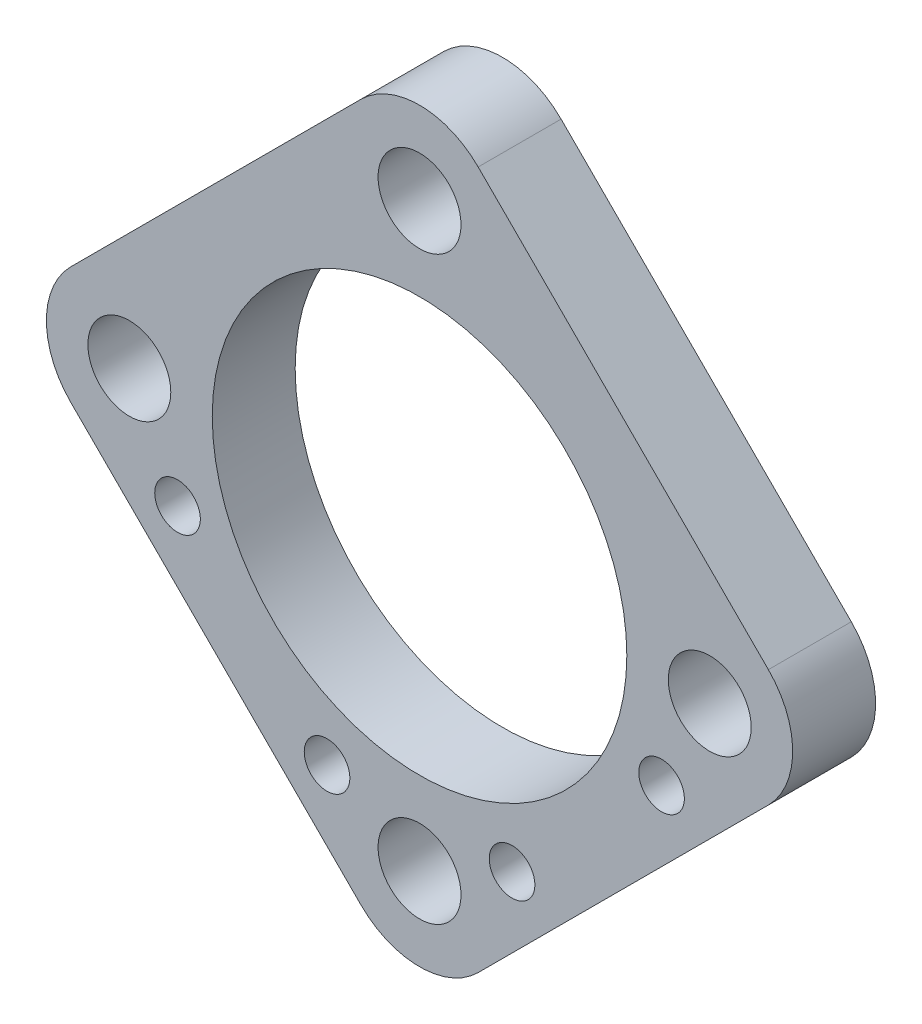
from build123d import *

# Parameters (mm, degrees)
SZKIC1_R                        = 5
SZKIC1_R_2                      = 25
DODANIE_WYCI_GNI_CIE1_DEPTH     = 10
WYTNIJ_WYCI_GNI_CIE1_DEPTH      = 65.420493634
WYTNIJ_WYCI_GNI_CIE1_DEPTH_BACK = 65.420493634
SZKIC2_R                        = 2.75


with BuildPart() as part:
    # Szkic1 → Dodanie-wyciągnięcie1 (new body)
    with BuildSketch(Plane.XY):
        with BuildLine():
            Line((-7.071067812, 42.071067812), (-42.071067812, 7.071067812))
            ThreePointArc((-42.071067812, 7.071067812), (-45, 0), (-42.071067812, -7.071067812))
            Line((-42.071067812, -7.071067812), (-7.071067812, -42.071067812))
            ThreePointArc((-7.071067812, -42.071067812), (0, -45), (7.071067812, -42.071067812))
            Line((7.071067812, -42.071067812), (42.071067812, -7.071067812))
            ThreePointArc((42.071067812, -7.071067812), (45, 0), (42.071067812, 7.071067812))
            Line((42.071067812, 7.071067812), (7.071067812, 42.071067812))
            ThreePointArc((7.071067812, 42.071067812), (0, 45), (-7.071067812, 42.071067812))
        make_face()
        with Locations((0, -35)):
            Circle(SZKIC1_R, mode=Mode.SUBTRACT)
        with Locations((-35, 0)):
            Circle(SZKIC1_R, mode=Mode.SUBTRACT)
        Circle(SZKIC1_R_2, mode=Mode.SUBTRACT)
        with Locations((35, 0)):
            Circle(SZKIC1_R, mode=Mode.SUBTRACT)
        with Locations((0, 35)):
            Circle(SZKIC1_R, mode=Mode.SUBTRACT)
    extrude(amount=DODANIE_WYCI_GNI_CIE1_DEPTH)

    # Szkic2 → Wytnij-wyciągnięcie1 (cut, two sides: drawn at the far end of the back side and taken through both)
    with BuildSketch(Plane(origin=(0, 0, 0), x_dir=(-1, 0, 0), z_dir=(0, 0, -1)).offset(-WYTNIJ_WYCI_GNI_CIE1_DEPTH_BACK)):
        with Locations((11.156854249, -29.5)):
            Circle(SZKIC2_R)
        with Locations((29.18807717, -11.46877708)):
            Circle(SZKIC2_R)
        with Locations((-11.156854249, -29.5)):
            Circle(SZKIC2_R)
        with Locations((-29.18807717, -11.46877708)):
            Circle(SZKIC2_R)
    extrude(amount=WYTNIJ_WYCI_GNI_CIE1_DEPTH + WYTNIJ_WYCI_GNI_CIE1_DEPTH_BACK, mode=Mode.SUBTRACT)


solid = part.part
